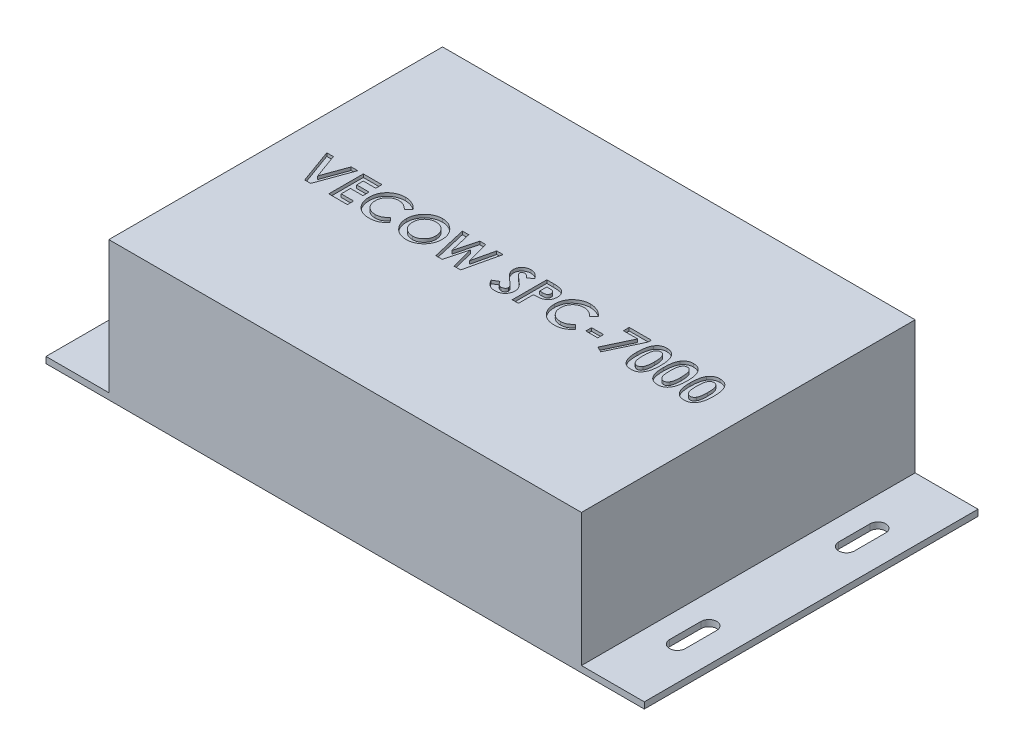
from build123d import *

# Parameters (mm, degrees)
SKETCH1_W           = 150.4
SKETCH1_H           = 106.2
BOSS_EXTRUDE1_DEPTH = 44.2
SKETCH2_W           = 106.2
SKETCH2_H           = 2
BOSS_EXTRUDE2_DEPTH = 20
CUT_EXTRUDE1_DEPTH  = 20
SKETCH4_W           = 3.807692308
SKETCH4_H           = 1.833333333
CUT_EXTRUDE2_DEPTH  = 1


with BuildPart() as part:
    # Sketch1 → Boss-Extrude1 (new body)
    with BuildSketch(Plane(origin=(0, 0, 0), x_dir=(1, 0, 0), z_dir=(0, 1, 0))):
        Rectangle(SKETCH1_W, SKETCH1_H)
    extrude(amount=BOSS_EXTRUDE1_DEPTH)

    # Sketch2 → Boss-Extrude2 (add)
    with BuildSketch(Plane(origin=(75.2, 0, 0), x_dir=(0, 0, -1), z_dir=(1, 0, 0))):
        with Locations((0, 1)):
            Rectangle(SKETCH2_W, SKETCH2_H)
    boss_extrude2 = extrude(amount=BOSS_EXTRUDE2_DEPTH)

    # Mirror1: Boss-Extrude2 across plane
    add(boss_extrude2.mirror(Plane(origin=(0, 0, 0), x_dir=(0, 0, 1), z_dir=(1, 0, 0))))

    # Sketch3 → Cut-Extrude1 (cut)
    with BuildSketch(Plane.XZ):
        with BuildLine():
            Line((-82.05, 31.9), (-82.05, 21.9))
            ThreePointArc((-82.05, 21.9), (-84.55, 19.4), (-87.05, 21.9))
            Line((-87.05, 21.9), (-87.05, 31.9))
            ThreePointArc((-87.05, 31.9), (-84.55, 34.4), (-82.05, 31.9))
        make_face()
        with BuildLine():
            Line((-82.05, -21.9), (-82.05, -31.9))
            ThreePointArc((-82.05, -31.9), (-84.55, -34.4), (-87.05, -31.9))
            Line((-87.05, -31.9), (-87.05, -21.9))
            ThreePointArc((-87.05, -21.9), (-84.55, -19.4), (-82.05, -21.9))
        make_face()
        with BuildLine():
            Line((87.05, 31.9), (87.05, 21.9))
            ThreePointArc((87.05, 21.9), (84.55, 19.4), (82.05, 21.9))
            Line((82.05, 21.9), (82.05, 31.9))
            ThreePointArc((82.05, 31.9), (84.55, 34.4), (87.05, 31.9))
        make_face()
        with BuildLine():
            Line((87.05, -21.9), (87.05, -31.9))
            ThreePointArc((87.05, -31.9), (84.55, -34.4), (82.05, -31.9))
            Line((82.05, -31.9), (82.05, -21.9))
            ThreePointArc((82.05, -21.9), (84.55, -19.4), (87.05, -21.9))
        make_face()
    extrude(amount=-CUT_EXTRUDE1_DEPTH, mode=Mode.SUBTRACT)

    # Sketch4 → Cut-Extrude2 (cut)
    # profile 1 of 13: a face of its own
    with BuildSketch(Plane(origin=(0, 44.2, 0), x_dir=(1, 0, 0), z_dir=(0, 1, 0))):
        Polygon((-64.448717949, 5.5), (-62.33994391, 5.5), (-59.512820513, -2.313701923), (-56.679086538, 5.5), (-54.576923077, 5.5), (-58.565304487, -5.5), (-60.466947115, -5.5), align=None)
    # profile 2 of 13: a face of its own
    with BuildSketch(Plane(origin=(0, 44.2, 0), x_dir=(1, 0, 0), z_dir=(0, 1, 0))):
        Polygon((-52.814102564, 5.5), (-46.891025641, 5.5), (-46.891025641, 3.525641026), (-50.83974359, 3.525641026), (-50.83974359, 1.41025641), (-46.891025641, 1.41025641), (-46.891025641, -0.564102564), (-50.83974359, -0.564102564), (-50.83974359, -3.525641026), (-46.891025641, -3.525641026), (-46.891025641, -5.5), (-52.814102564, -5.5), align=None)
    # profile 3 of 13: a face of its own
    with BuildSketch(Plane(origin=(0, 44.2, 0), x_dir=(1, 0, 0), z_dir=(0, 1, 0))):
        with BuildLine():
            Line((-35.044871795, 3.591746795), (-36.492588141, 2.207932692))
            add(Edge.make_bspline(
                [(-36.492588141, 2.207932692), (-36.615395236, 2.334915434), (-36.855275966, 2.582952511), (-37.241814096, 2.911331743), (-37.643799677, 3.184991401), (-38.053412882, 3.415465822), (-38.478021466, 3.589836148), (-38.912715796, 3.716902742), (-39.360271524, 3.794370441), (-39.663160026, 3.803234117), (-39.815504808, 3.807692308)],
                knots=[0, 0, 0, 0, 1.115251505, 2.178435587, 3.19620269, 4.182487026, 5.141301733, 6.088180966, 7.038406374, 8, 8, 8, 8], degree=3))
            add(Edge.make_bspline(
                [(-39.815504808, 3.807692308), (-39.942731214, 3.804170181), (-40.193798509, 3.797219652), (-40.56243109, 3.74626542), (-40.915047205, 3.659615531), (-41.252853916, 3.540195934), (-41.57485721, 3.385673312), (-41.881732208, 3.196167264), (-42.172722323, 2.973389298), (-42.443983744, 2.718492077), (-42.692124158, 2.439997709), (-42.911372014, 2.142844883), (-43.095027263, 1.827714358), (-43.245750138, 1.497797546), (-43.363157431, 1.151567429), (-43.44700099, 0.789257101), (-43.495493863, 0.41043508), (-43.50273175, 0.152914693), (-43.506410256, 0.022035256)],
                knots=[0, 0, 0, 0, 1.035432265, 2.043311493, 3.022114605, 3.98653278, 4.95457646, 5.923598177, 6.917315552, 7.932509744, 8.948865224, 9.949768934, 10.933144597, 11.912367597, 12.897413939, 13.903909035, 14.934704909, 16, 16, 16, 16], degree=3))
            add(Edge.make_bspline(
                [(-43.506410256, 0.022035256), (-43.505350153, -0.069825089), (-43.503260667, -0.250883719), (-43.480387545, -0.518719682), (-43.443556427, -0.778583886), (-43.390252673, -1.030082705), (-43.323595804, -1.273434091), (-43.24539212, -1.510737424), (-43.147286749, -1.738713706), (-43.038388306, -1.960010733), (-42.911740672, -2.168590139), (-42.77519116, -2.367487913), (-42.627125507, -2.555729078), (-42.466584685, -2.732544099), (-42.291309281, -2.895169753), (-42.105829515, -3.048496386), (-41.907016601, -3.188685713), (-41.699000387, -3.319255941), (-41.479983875, -3.432683409), (-41.255909491, -3.535426781), (-41.023379816, -3.618869676), (-40.785226039, -3.686132261), (-40.542299237, -3.743329044), (-40.29222336, -3.778546861), (-40.037166253, -3.805216901), (-39.86479046, -3.80686362), (-39.778044872, -3.807692308)],
                knots=[0, 0, 0, 0, 1.103660481, 2.175337485, 3.227646561, 4.255952547, 5.262355991, 6.258840057, 7.255597736, 8.242457506, 9.22035537, 10.185017736, 11.140346927, 12.096287581, 13.051739095, 14.01125915, 14.986044842, 15.97314143, 16.960198552, 17.947847494, 18.933482797, 19.925264591, 20.920966487, 21.929612487, 22.958107872, 24, 24, 24, 24], degree=3))
            add(Edge.make_bspline(
                [(-39.778044872, -3.807692308), (-39.630909447, -3.80343637), (-39.341826599, -3.79507456), (-38.917555952, -3.72968639), (-38.513268294, -3.622126549), (-38.190244389, -3.495104628), (-37.937163692, -3.369668831), (-37.744497099, -3.253646896), (-37.545264825, -3.123863624), (-37.342775949, -2.975420852), (-37.134752871, -2.810099954), (-36.924867679, -2.624280094), (-36.707747276, -2.424080053), (-36.565513851, -2.28119335), (-36.492588141, -2.207932692)],
                knots=[0, 0, 0, 0, 1.404581149, 2.759636711, 4.088442092, 5.392261763, 6.066678138, 6.783632037, 7.538459478, 8.336747902, 9.180226004, 10.074962426, 11.012997595, 12, 12, 12, 12], degree=3))
            Line((-36.492588141, -2.207932692), (-35.088942308, -3.682091346))
            add(Edge.make_bspline(
                [(-35.088942308, -3.682091346), (-35.187611055, -3.777352924), (-35.380191347, -3.96328315), (-35.670693373, -4.227286723), (-35.96082979, -4.46452328), (-36.243591508, -4.683603471), (-36.523610458, -4.878144956), (-36.800856944, -5.048342027), (-37.072192415, -5.198499214), (-37.34325124, -5.326084189), (-37.615720086, -5.434417085), (-37.896058509, -5.527684597), (-38.185123529, -5.606585556), (-38.484680625, -5.670248269), (-38.791935711, -5.72129717), (-39.109764285, -5.755754883), (-39.436151157, -5.778919656), (-39.657544429, -5.781001203), (-39.769230769, -5.782051282)],
                knots=[0, 0, 0, 0, 1.244526981, 2.429050516, 3.560637417, 4.644440555, 5.67424972, 6.652764056, 7.595344123, 8.486817594, 9.369275933, 10.254498637, 11.166417451, 12.086725134, 13.032340136, 13.991389299, 14.986715468, 16, 16, 16, 16], degree=3))
            add(Edge.make_bspline(
                [(-39.769230769, -5.782051282), (-39.974384742, -5.776821498), (-40.37581404, -5.766588265), (-40.964098209, -5.690766934), (-41.522952379, -5.563653809), (-42.053736136, -5.383880789), (-42.556280703, -5.154229181), (-43.030457516, -4.872687094), (-43.475502305, -4.54000254), (-43.887819985, -4.160074905), (-44.260780949, -3.740476727), (-44.590435251, -3.289943397), (-44.863125301, -2.806260707), (-45.089545726, -2.296574198), (-45.266603521, -1.75855797), (-45.391222192, -1.191630055), (-45.468073617, -0.596337857), (-45.476481272, -0.189739563), (-45.480769231, 0.017628205)],
                knots=[0, 0, 0, 0, 1.078019885, 2.10938526, 3.111377082, 4.085535484, 5.04941344, 6.010039228, 6.978205633, 7.964457913, 8.951525778, 9.924444315, 10.892603023, 11.863865945, 12.85144698, 13.863884204, 14.910567087, 16, 16, 16, 16], degree=3))
            add(Edge.make_bspline(
                [(-45.480769231, 0.017628205), (-45.478957347, 0.152871694), (-45.475366637, 0.420891234), (-45.43762794, 0.815705731), (-45.385018001, 1.200579245), (-45.301557117, 1.571515511), (-45.200953253, 1.933511728), (-45.075839131, 2.282633417), (-44.926414574, 2.61988399), (-44.757495889, 2.945828025), (-44.56639987, 3.258330239), (-44.352924639, 3.554705746), (-44.122565879, 3.83724251), (-43.869788447, 4.102192156), (-43.598265528, 4.351880994), (-43.306771228, 4.584955911), (-42.99705874, 4.804759466), (-42.668289787, 5.005623459), (-42.326851474, 5.187315616), (-41.977050236, 5.347575858), (-41.619745495, 5.481516516), (-41.256447967, 5.59261535), (-40.885622725, 5.675542775), (-40.509916625, 5.73831616), (-40.12613286, 5.773406884), (-39.868455309, 5.779151459), (-39.73838141, 5.782051282)],
                knots=[0, 0, 0, 0, 1.071919942, 2.124283339, 3.142214191, 4.149696895, 5.136002878, 6.119640489, 7.086990633, 8.058538607, 9.028339693, 9.988281803, 10.952401235, 11.916291999, 12.888973767, 13.874849856, 14.873389453, 15.898127285, 16.927174885, 17.938320013, 18.946391617, 19.950418109, 20.947802303, 21.956882652, 22.968648068, 24, 24, 24, 24], degree=3))
            add(Edge.make_bspline(
                [(-39.73838141, 5.782051282), (-39.627415038, 5.780389031), (-39.406636033, 5.777081812), (-39.077859048, 5.749512542), (-38.751711467, 5.706215282), (-38.429360999, 5.640888938), (-38.108501864, 5.563338311), (-37.79335051, 5.461796463), (-37.478935254, 5.348608938), (-37.170187233, 5.213316364), (-36.866675479, 5.065632298), (-36.575510235, 4.898079361), (-36.291802861, 4.720968575), (-36.021840143, 4.523817748), (-35.760565098, 4.313777905), (-35.509343957, 4.089869094), (-35.270381331, 3.848358097), (-35.120421655, 3.677716321), (-35.044871795, 3.591746795)],
                knots=[0, 0, 0, 0, 0.996412454, 1.982464992, 2.961075852, 3.949442424, 4.934965278, 5.923860011, 6.921385422, 7.934793307, 8.949617135, 9.951082467, 10.950285876, 11.951772932, 12.951063433, 13.960125323, 14.972308753, 16, 16, 16, 16], degree=3))
        make_face()
    # profile 4 of 13: a face of its own
    with BuildSketch(Plane(origin=(0, 44.2, 0), x_dir=(1, 0, 0), z_dir=(0, 1, 0))):
        with BuildLine():
            add(Edge.make_bspline(
                [(-27.901041667, 5.782051282), (-27.709793185, 5.777099516), (-27.332225367, 5.767323609), (-26.776959355, 5.685833795), (-26.241857885, 5.553057825), (-25.727162927, 5.368489624), (-25.234163219, 5.127130145), (-24.761119785, 4.83582209), (-24.309727044, 4.489067192), (-23.884610508, 4.094954672), (-23.491726158, 3.666374516), (-23.151291639, 3.204931782), (-22.86098157, 2.722582915), (-22.620371808, 2.218035447), (-22.437102689, 1.687795147), (-22.308495169, 1.134565539), (-22.225871208, 0.558504013), (-22.216368181, 0.166284631), (-22.211538462, -0.033052885)],
                knots=[0, 0, 0, 0, 1.014329547, 2.002516266, 2.970391464, 3.935626869, 4.897733899, 5.877609409, 6.878433252, 7.912639331, 8.949961323, 9.958554974, 10.949718813, 11.932905612, 12.9188844, 13.919928257, 14.942845884, 16, 16, 16, 16], degree=3))
            add(Edge.make_bspline(
                [(-22.211538462, -0.033052885), (-22.216681904, -0.230144327), (-22.226817223, -0.618519338), (-22.305122097, -1.18927223), (-22.435895385, -1.736575596), (-22.616056115, -2.261668269), (-22.852302125, -2.762006879), (-23.136950832, -3.24078602), (-23.477513572, -3.693562506), (-23.861568687, -4.12009336), (-24.284380038, -4.507261634), (-24.732204379, -4.848453007), (-25.202973934, -5.1375657), (-25.695999647, -5.374467287), (-26.212338788, -5.558317884), (-26.750715935, -5.688037839), (-27.311097775, -5.766871275), (-27.692184601, -5.776940391), (-27.885616987, -5.782051282)],
                knots=[0, 0, 0, 0, 1.051557043, 2.072126891, 3.067553643, 4.050577992, 5.02905126, 6.015227836, 7.017913613, 8.04756643, 9.074058332, 10.072836633, 11.047628519, 12.017157415, 12.98668631, 13.966869689, 14.968021931, 16, 16, 16, 16], degree=3))
            add(Edge.make_bspline(
                [(-27.885616987, -5.782051282), (-28.087924069, -5.777466561), (-28.485429833, -5.768458211), (-29.067181298, -5.682792916), (-29.624549469, -5.553751057), (-30.152852132, -5.361163004), (-30.657469599, -5.120411744), (-31.134694296, -4.823912134), (-31.584365846, -4.472154161), (-32.003904858, -4.074146479), (-32.384008219, -3.638638778), (-32.719523992, -3.178563512), (-33.00253899, -2.697435252), (-33.233063567, -2.19502882), (-33.414799883, -1.674466549), (-33.542994205, -1.132578064), (-33.61872165, -0.570663012), (-33.629270044, -0.188999076), (-33.634615385, 0.004407051)],
                knots=[0, 0, 0, 0, 1.067978421, 2.098431617, 3.099715153, 4.085208694, 5.062210972, 6.048429807, 7.046490867, 8.072918869, 9.098532598, 10.095778865, 11.076610158, 12.041847152, 13.011192615, 13.984257998, 14.978533688, 16, 16, 16, 16], degree=3))
            add(Edge.make_bspline(
                [(-33.634615385, 0.004407051), (-33.632937709, 0.134520569), (-33.6296036, 0.393100068), (-33.589440749, 0.776301686), (-33.53161779, 1.152023723), (-33.446100377, 1.51876817), (-33.342218579, 1.879122238), (-33.207625034, 2.229731663), (-33.054421156, 2.574341916), (-32.875416849, 2.90888272), (-32.676381368, 3.23027602), (-32.459215938, 3.537005747), (-32.223374498, 3.825363091), (-31.969616774, 4.097243016), (-31.69706828, 4.350858438), (-31.409314111, 4.589799634), (-31.100773511, 4.807719478), (-30.778199467, 5.009940006), (-30.443410576, 5.192804523), (-30.097769733, 5.348453331), (-29.748397822, 5.484378783), (-29.390627705, 5.59165716), (-29.028293527, 5.679034276), (-28.657524479, 5.736818263), (-28.28167025, 5.776980002), (-28.028218964, 5.780356844), (-27.901041667, 5.782051282)],
                knots=[0, 0, 0, 0, 1.034744296, 2.056386356, 3.06226378, 4.057406941, 5.050368692, 6.043467995, 7.042652155, 8.049140477, 9.059438543, 10.048523776, 11.036952808, 12.020949711, 13.004946614, 13.997082645, 14.994316842, 16.007702937, 17.024872941, 18.026463647, 19.021641123, 20.005082605, 20.995858141, 21.984425357, 22.988620895, 24, 24, 24, 24], degree=3))
        make_face()
        with BuildLine():
            add(Edge.make_bspline(
                [(-27.931891026, 3.807692308), (-28.060601228, 3.804238724), (-28.314623663, 3.797422732), (-28.687228313, 3.745494089), (-29.044941936, 3.662558145), (-29.385781583, 3.542426444), (-29.711224483, 3.389529277), (-30.021847546, 3.204400887), (-30.313349284, 2.980677691), (-30.589616592, 2.730370391), (-30.839178644, 2.451470535), (-31.05967459, 2.152581907), (-31.244194182, 1.834203647), (-31.398730496, 1.499293413), (-31.51506209, 1.144085228), (-31.597921597, 0.771361477), (-31.650285712, 0.380479937), (-31.656886274, 0.114016501), (-31.66025641, -0.022035256)],
                knots=[0, 0, 0, 0, 1.033739768, 2.040188636, 3.016340934, 3.979330865, 4.937572243, 5.900995986, 6.878200029, 7.884839167, 8.891893314, 9.879764717, 10.863503415, 11.843163062, 12.837761627, 13.859916423, 14.907309254, 16, 16, 16, 16], degree=3))
            add(Edge.make_bspline(
                [(-31.66025641, -0.022035256), (-31.655788124, -0.172811208), (-31.647031024, -0.46830709), (-31.585415004, -0.899368522), (-31.479996127, -1.306463262), (-31.327773318, -1.68760027), (-31.138977098, -2.047011787), (-30.904522158, -2.380292714), (-30.628205556, -2.689438582), (-30.415333485, -2.869930817), (-30.307291667, -2.961538462)],
                knots=[0, 0, 0, 0, 1.078454662, 2.113592447, 3.107694534, 4.079536787, 5.043276885, 6.005368276, 6.987637804, 8, 8, 8, 8], degree=3))
            add(Edge.make_bspline(
                [(-30.307291667, -2.961538462), (-30.218784791, -3.029214671), (-30.043765116, -3.163042334), (-29.764395608, -3.334569938), (-29.476700026, -3.481586206), (-29.178507345, -3.600373611), (-28.870447333, -3.693809787), (-28.552562235, -3.759241605), (-28.225302466, -3.800305729), (-28.003994073, -3.80521367), (-27.892227564, -3.807692308)],
                knots=[0, 0, 0, 0, 1.023928204, 2.024787132, 3.009472467, 3.9914905, 4.972207045, 5.96565515, 6.972602802, 8, 8, 8, 8], degree=3))
            add(Edge.make_bspline(
                [(-27.892227564, -3.807692308), (-27.765730537, -3.804209441), (-27.516843657, -3.797356792), (-27.151175243, -3.74606742), (-26.800853797, -3.659267284), (-26.463704493, -3.540189421), (-26.140699519, -3.385372498), (-25.833417487, -3.194502005), (-25.54131965, -2.969921588), (-25.265404304, -2.716327205), (-25.013204634, -2.436328676), (-24.793168818, -2.135845807), (-24.602782425, -1.821499135), (-24.451459696, -1.48883956), (-24.330532103, -1.141007231), (-24.248669853, -0.776461676), (-24.19586338, -0.396705688), (-24.189260958, -0.138268318), (-24.185897436, -0.006610577)],
                knots=[0, 0, 0, 0, 1.026359118, 2.019393844, 2.989460624, 3.950973911, 4.916101784, 5.890408035, 6.881132271, 7.902007068, 8.92769091, 9.933912415, 10.920395702, 11.90457117, 12.894218921, 13.903490204, 14.931958862, 16, 16, 16, 16], degree=3))
            add(Edge.make_bspline(
                [(-24.185897436, -0.006610577), (-24.189377337, 0.124290095), (-24.196226991, 0.381948105), (-24.247606635, 0.760727743), (-24.333856307, 1.123663937), (-24.453291749, 1.4713494), (-24.605804484, 1.804124994), (-24.794401953, 2.120820481), (-25.018422391, 2.421129696), (-25.272709981, 2.703006146), (-25.549486393, 2.962032547), (-25.846633528, 3.186820378), (-26.155836873, 3.382153855), (-26.484191063, 3.535170214), (-26.824978246, 3.657078022), (-27.180277923, 3.746852682), (-27.551435813, 3.79705793), (-27.8039422, 3.804115918), (-27.931891026, 3.807692308)],
                knots=[0, 0, 0, 0, 1.055025985, 2.07665775, 3.074803781, 4.057872707, 5.035505728, 6.020516407, 7.023567878, 8.050795229, 9.077271434, 10.074415901, 11.050397877, 12.019801805, 12.988065821, 13.964604439, 14.968634123, 16, 16, 16, 16], degree=3))
        make_face(mode=Mode.SUBTRACT)
    # profile 5 of 13: a face of its own
    with BuildSketch(Plane(origin=(0, 44.2, 0), x_dir=(1, 0, 0), z_dir=(0, 1, 0))):
        Polygon((-21.294871795, 5.5), (-19.256610577, 5.5), (-17.628205128, -1.522636218), (-15.76181891, 5.5), (-13.842548077, 5.5), (-11.987179487, -1.522636218), (-10.36318109, 5.5), (-8.320512821, 5.5), (-10.865584936, -5.5), (-12.928084936, -5.5), (-14.807692308, 1.610777244), (-16.698317308, -5.5), (-18.745392628, -5.5), align=None)
    # profile 6 of 13: a face of its own
    with BuildSketch(Plane(origin=(0, 44.2, 0), x_dir=(1, 0, 0), z_dir=(0, 1, 0))):
        with BuildLine():
            Line((3.314102564, 4.030248397), (1.837740385, 2.679487179))
            add(Edge.make_bspline(
                [(1.837740385, 2.679487179), (1.774499359, 2.76869522), (1.65308541, 2.939962218), (1.456286062, 3.169292765), (1.260375364, 3.364928788), (1.063538323, 3.52605301), (0.864030249, 3.651686482), (0.66219746, 3.740636368), (0.459184202, 3.797182654), (0.322790631, 3.804224028), (0.255608974, 3.807692308)],
                knots=[0, 0, 0, 0, 1.299362458, 2.494594718, 3.587462134, 4.587049575, 5.512617175, 6.380583204, 7.202344345, 8, 8, 8, 8], degree=3))
            add(Edge.make_bspline(
                [(0.255608974, 3.807692308), (0.192943852, 3.805494646), (0.071953965, 3.80125154), (-0.100526096, 3.759075374), (-0.25365635, 3.686285507), (-0.387287349, 3.591106632), (-0.493142816, 3.476438153), (-0.577660197, 3.356180403), (-0.625250585, 3.223443044), (-0.631514417, 3.132273671), (-0.634615385, 3.087139423)],
                knots=[0, 0, 0, 0, 1.185010067, 2.2879431, 3.333075148, 4.379039566, 5.372662701, 6.27520591, 7.14612461, 8, 8, 8, 8], degree=3))
            add(Edge.make_bspline(
                [(-0.634615385, 3.087139423), (-0.632672165, 3.041354319), (-0.628758791, 2.949149483), (-0.590960925, 2.814011813), (-0.533988747, 2.681966577), (-0.479549506, 2.601584359), (-0.451722756, 2.560496795)],
                knots=[0, 0, 0, 0, 0.967525499, 1.948461899, 2.951351359, 4, 4, 4, 4], degree=3))
            add(Edge.make_bspline(
                [(-0.451722756, 2.560496795), (-0.426425231, 2.528559861), (-0.368193669, 2.455045257), (-0.257158006, 2.338609584), (-0.117720532, 2.195965693), (0.055484599, 2.032018689), (0.255267167, 1.840872397), (0.490887351, 1.630040849), (0.755562975, 1.39299484), (0.943688277, 1.227924582), (1.042267628, 1.141426282)],
                knots=[0, 0, 0, 0, 0.473873513, 1.090794244, 1.870441696, 2.795289791, 3.865433203, 5.087734844, 6.473946851, 8, 8, 8, 8], degree=3))
            add(Edge.make_bspline(
                [(1.042267628, 1.141426282), (1.13479853, 1.061345454), (1.310402957, 0.90936868), (1.560253185, 0.693662051), (1.779829923, 0.499596056), (1.972331903, 0.330083211), (2.134840983, 0.183344938), (2.268040353, 0.05867983), (2.373556815, -0.041485113), (2.433536746, -0.1019848), (2.459134615, -0.127804487)],
                knots=[0, 0, 0, 0, 1.543621617, 2.929473131, 4.163658386, 5.240097082, 6.164993805, 6.925417477, 7.541396219, 8, 8, 8, 8], degree=3))
            add(Edge.make_bspline(
                [(2.459134615, -0.127804487), (2.556247595, -0.23290153), (2.742932847, -0.434934954), (2.985557863, -0.748023224), (3.1852461, -1.053661215), (3.339728706, -1.357600003), (3.456400184, -1.664224818), (3.538655121, -1.981055618), (3.587918151, -2.311403086), (3.593387497, -2.536824905), (3.596153846, -2.650841346)],
                knots=[0, 0, 0, 0, 1.206664779, 2.319633467, 3.337109185, 4.282041471, 5.190008762, 6.099243693, 7.03861361, 8, 8, 8, 8], degree=3))
            add(Edge.make_bspline(
                [(3.596153846, -2.650841346), (3.59418483, -2.761936385), (3.590321546, -2.979908986), (3.543003734, -3.298879419), (3.47553131, -3.604147967), (3.371207107, -3.892392876), (3.244057385, -4.1683456), (3.084656845, -4.427707671), (2.897462768, -4.67310394), (2.682909613, -4.900147649), (2.445588347, -5.106174078), (2.191038735, -5.289583671), (1.916771662, -5.441011652), (1.625130423, -5.565701793), (1.316271127, -5.661739808), (0.990561718, -5.732720851), (0.647504002, -5.775322554), (0.412916192, -5.779776056), (0.29306891, -5.782051282)],
                knots=[0, 0, 0, 0, 1.043214005, 2.046824704, 3.02475056, 3.976699089, 4.921714032, 5.875962561, 6.831408892, 7.817874052, 8.806269674, 9.781291748, 10.760897367, 11.74438705, 12.757449933, 13.795994037, 14.874007457, 16, 16, 16, 16], degree=3))
            add(Edge.make_bspline(
                [(0.29306891, -5.782051282), (0.198989814, -5.780382256), (0.01265925, -5.777076628), (-0.261963832, -5.750088924), (-0.527143461, -5.706533641), (-0.782580938, -5.64410591), (-1.029427053, -5.565001507), (-1.267691943, -5.46837851), (-1.495730787, -5.352739298), (-1.715269035, -5.220461872), (-1.92523946, -5.066870357), (-2.128297056, -4.895104881), (-2.322424861, -4.702523613), (-2.508555232, -4.489582001), (-2.685497255, -4.255677046), (-2.859042878, -4.004066307), (-3.021479211, -3.73008023), (-3.12182336, -3.537876781), (-3.173076923, -3.439703526)],
                knots=[0, 0, 0, 0, 1.016823716, 2.013894106, 2.979844003, 3.91962641, 4.853723003, 5.779685073, 6.695824784, 7.614987388, 8.547259901, 9.504950863, 10.487499108, 11.500346958, 12.559593716, 13.656357062, 14.802919212, 16, 16, 16, 16], degree=3))
            Line((-3.173076923, -3.439703526), (-1.436698718, -2.397435897))
            add(Edge.make_bspline(
                [(-1.436698718, -2.397435897), (-1.37258817, -2.508875369), (-1.249682771, -2.722514361), (-1.041408082, -3.009565424), (-0.828041296, -3.255377144), (-0.604649564, -3.455604782), (-0.373949245, -3.61292564), (-0.134826004, -3.72535804), (0.112888162, -3.794953568), (0.281619799, -3.803452789), (0.365785256, -3.807692308)],
                knots=[0, 0, 0, 0, 1.283663364, 2.460892379, 3.537111102, 4.529833553, 5.449777664, 6.316464042, 7.160231139, 8, 8, 8, 8], degree=3))
            add(Edge.make_bspline(
                [(0.365785256, -3.807692308), (0.451393577, -3.804230087), (0.617486186, -3.797512875), (0.854562131, -3.735468013), (1.071922335, -3.638053027), (1.259806889, -3.499055276), (1.418895684, -3.338630745), (1.536312346, -3.160151119), (1.610074285, -2.967040472), (1.617872711, -2.832893114), (1.621794872, -2.765424679)],
                knots=[0, 0, 0, 0, 1.13588714, 2.203786484, 3.234766741, 4.283437687, 5.291419208, 6.222934724, 7.106237994, 8, 8, 8, 8], degree=3))
            add(Edge.make_bspline(
                [(1.621794872, -2.765424679), (1.618172917, -2.702656281), (1.610815261, -2.575148287), (1.55662104, -2.385564404), (1.471898942, -2.196066741), (1.371666726, -2.04063563), (1.269667896, -1.910497374), (1.172134008, -1.797738463), (1.053363533, -1.673159606), (0.913657621, -1.536604093), (0.754862152, -1.386869792), (0.57684336, -1.223971364), (0.377562743, -1.04934375), (0.23671081, -0.930389145), (0.163060897, -0.868189103)],
                knots=[0, 0, 0, 0, 0.916159276, 1.861089862, 2.860218735, 3.940849679, 4.552606315, 5.27541173, 6.11797699, 7.06649574, 8.129236253, 9.306560635, 10.591630461, 12, 12, 12, 12], degree=3))
            add(Edge.make_bspline(
                [(0.163060897, -0.868189103), (0.023049483, -0.74972602), (-0.2456748, -0.522359508), (-0.625416304, -0.186546328), (-0.967597402, 0.127301859), (-1.269262648, 0.423064902), (-1.534255726, 0.695280745), (-1.760781987, 0.946160427), (-1.946352936, 1.177639143), (-2.141626346, 1.451810191), (-2.327175128, 1.785906452), (-2.48754193, 2.187862985), (-2.591581142, 2.589768516), (-2.603237289, 2.859585752), (-2.608974359, 2.992387821)],
                knots=[0, 0, 0, 0, 1.345494975, 2.582412109, 3.71882943, 4.751509156, 5.681369928, 6.505683931, 7.230279997, 7.856715994, 8.973648664, 10.023341002, 11.027102913, 12, 12, 12, 12], degree=3))
            add(Edge.make_bspline(
                [(-2.608974359, 2.992387821), (-2.606588319, 3.086563919), (-2.601887564, 3.272100951), (-2.559956107, 3.544906121), (-2.497287947, 3.808140189), (-2.406275786, 4.060842756), (-2.288152991, 4.302697302), (-2.144697445, 4.534887807), (-1.973681554, 4.755277242), (-1.780958191, 4.963719504), (-1.568626388, 5.154212011), (-1.341722872, 5.322340736), (-1.101531939, 5.464344701), (-0.849522953, 5.582147302), (-0.584134322, 5.67231771), (-0.30732115, 5.736234989), (-0.018686399, 5.774250948), (0.177636728, 5.779418777), (0.277644231, 5.782051282)],
                knots=[0, 0, 0, 0, 1.010766082, 1.991317756, 2.957454644, 3.913069143, 4.869106762, 5.843196583, 6.838735724, 7.860187025, 8.887984031, 9.89767229, 10.887916223, 11.879572884, 12.879850636, 13.892031539, 14.926195476, 16, 16, 16, 16], degree=3))
            add(Edge.make_bspline(
                [(0.277644231, 5.782051282), (0.407249005, 5.777310063), (0.665435498, 5.767865051), (1.047171675, 5.694008144), (1.420035612, 5.577860377), (1.72049636, 5.437740875), (1.959567369, 5.302007047), (2.142792965, 5.177040437), (2.329234872, 5.033884467), (2.520396627, 4.872088018), (2.712726149, 4.68860263), (2.911692287, 4.487796318), (3.114583883, 4.267933646), (3.246431251, 4.110864772), (3.314102564, 4.030248397)],
                knots=[0, 0, 0, 0, 1.282922637, 2.555718331, 3.837320111, 5.142675274, 5.830281639, 6.55870424, 7.337177975, 8.157850921, 9.037902056, 9.96903443, 10.957596896, 12, 12, 12, 12], degree=3))
        make_face()
    # profile 7 of 13: a face of its own
    with BuildSketch(Plane(origin=(0, 44.2, 0), x_dir=(1, 0, 0), z_dir=(0, 1, 0))):
        with BuildLine():
            Line((5.570512821, 5.5), (7.774038462, 5.5))
            add(Edge.make_bspline(
                [(7.774038462, 5.5), (7.918013968, 5.499355535), (8.1957729, 5.498112227), (8.596324132, 5.483035462), (8.965852255, 5.456016982), (9.304272372, 5.422626413), (9.611445331, 5.375814135), (9.887755807, 5.322147523), (10.133261139, 5.25676597), (10.350729766, 5.179158973), (10.545900834, 5.087663356), (10.730595613, 4.990213992), (10.90063998, 4.873911614), (11.064616588, 4.751290797), (11.213150613, 4.610637622), (11.355508495, 4.461312763), (11.485660989, 4.297394117), (11.604211175, 4.120865875), (11.711754461, 3.934989526), (11.80571147, 3.739432777), (11.881924134, 3.53388618), (11.945857082, 3.319679388), (11.99720865, 3.096821736), (12.031389887, 2.863942631), (12.054607504, 2.622668122), (12.056656138, 2.458456539), (12.057692308, 2.375400641)],
                knots=[0, 0, 0, 0, 1.698747864, 3.27724071, 4.728299578, 6.070144658, 7.288476769, 8.393259625, 9.389771311, 10.283485332, 11.113357557, 11.931608583, 12.74405601, 13.541433047, 14.344816069, 15.154114104, 15.974336324, 16.810834471, 17.661136416, 18.50621059, 19.367396281, 20.244825668, 21.142564693, 22.063065223, 23.020325768, 24, 24, 24, 24], degree=3))
            add(Edge.make_bspline(
                [(12.057692308, 2.375400641), (12.056193099, 2.283517879), (12.05324697, 2.102956961), (12.024365413, 1.838276807), (11.975026589, 1.585928243), (11.910543326, 1.343783171), (11.820626002, 1.115825411), (11.717899682, 0.896615824), (11.591513724, 0.692300371), (11.447097563, 0.500323314), (11.289378639, 0.319123788), (11.114612712, 0.153933587), (10.926130895, 0.003626614), (10.725024244, -0.133372358), (10.510537741, -0.256786973), (10.282826152, -0.367772877), (10.04033453, -0.462780397), (9.871470661, -0.512468561), (9.785857372, -0.537660256)],
                knots=[0, 0, 0, 0, 1.102006807, 2.165578795, 3.188629044, 4.184801286, 5.166646146, 6.124351954, 7.085497154, 8.042432466, 9.003981491, 9.963833307, 10.922997304, 11.89326795, 12.880200226, 13.889073926, 14.929769137, 16, 16, 16, 16], degree=3))
            add(Edge.make_bspline(
                [(9.785857372, -0.537660256), (9.729467535, -0.551690139), (9.607308989, -0.582083383), (9.405170148, -0.612940154), (9.172226358, -0.641311058), (8.907724358, -0.665692415), (8.611511657, -0.682266057), (8.283875067, -0.695209334), (7.924666107, -0.704620433), (7.674886401, -0.70495438), (7.544871795, -0.705128205)],
                knots=[0, 0, 0, 0, 0.618981996, 1.340914327, 2.176866532, 3.120127938, 4.170906482, 5.338178032, 6.614476169, 8, 8, 8, 8], degree=3))
            Line((7.544871795, -0.705128205), (7.544871795, -5.5))
            Line((7.544871795, -5.5), (5.570512821, -5.5))
            Line((5.570512821, -5.5), (5.570512821, 5.5))
        make_face()
        with BuildLine():
            Line((7.544871795, 1.269230769), (8.243389423, 1.269230769))
            add(Edge.make_bspline(
                [(8.243389423, 1.269230769), (8.370495734, 1.270036722), (8.604373233, 1.271519687), (8.923767308, 1.292964221), (9.18043853, 1.325714356), (9.383213562, 1.372685624), (9.543323655, 1.443970742), (9.681408587, 1.526434201), (9.799847559, 1.63070698), (9.902398275, 1.749856472), (9.984384483, 1.886765211), (10.041237648, 2.039203902), (10.078168345, 2.203969647), (10.081579238, 2.318635699), (10.083333333, 2.377604167)],
                knots=[0, 0, 0, 0, 1.8619151, 3.425951444, 4.686033666, 5.651700536, 6.461346321, 7.243864085, 7.999046032, 8.762387399, 9.539336099, 10.322741239, 11.137448474, 12, 12, 12, 12], degree=3))
            add(Edge.make_bspline(
                [(10.083333333, 2.377604167), (10.081597282, 2.429124149), (10.078228924, 2.529085301), (10.053484053, 2.673354038), (10.014047847, 2.807842263), (9.9569063, 2.931145423), (9.88303581, 3.043054007), (9.792972734, 3.14352393), (9.687872758, 3.234706841), (9.606729432, 3.282971348), (9.565504808, 3.307491987)],
                knots=[0, 0, 0, 0, 1.102301479, 2.1387299, 3.123554645, 4.094223062, 5.036071848, 5.982632524, 6.975082478, 8, 8, 8, 8], degree=3))
            add(Edge.make_bspline(
                [(9.565504808, 3.307491987), (9.530585171, 3.325151849), (9.456653144, 3.362541395), (9.330739735, 3.406009476), (9.185437584, 3.44267959), (9.019765737, 3.473115431), (8.834385107, 3.496736805), (8.629328769, 3.514801246), (8.404294963, 3.522065662), (8.247797416, 3.524416366), (8.166266026, 3.525641026)],
                knots=[0, 0, 0, 0, 0.656809284, 1.390599849, 2.23162475, 3.173112763, 4.218524733, 5.370385145, 6.63003504, 8, 8, 8, 8], degree=3))
            Line((8.166266026, 3.525641026), (7.544871795, 3.525641026))
            Line((7.544871795, 3.525641026), (7.544871795, 1.269230769))
        make_face(mode=Mode.SUBTRACT)
    # profile 8 of 13: a face of its own
    with BuildSketch(Plane(origin=(0, 44.2, 0), x_dir=(1, 0, 0), z_dir=(0, 1, 0))):
        with BuildLine():
            Line((23.903846154, 3.591746795), (22.456129808, 2.207932692))
            add(Edge.make_bspline(
                [(22.456129808, 2.207932692), (22.333322713, 2.334915434), (22.093441983, 2.582952511), (21.706903853, 2.911331743), (21.304918272, 3.184991401), (20.895305067, 3.415465822), (20.470696483, 3.589836148), (20.036002153, 3.716902742), (19.588446425, 3.794370441), (19.285557923, 3.803234117), (19.133213141, 3.807692308)],
                knots=[0, 0, 0, 0, 1.115251505, 2.178435587, 3.19620269, 4.182487026, 5.141301733, 6.088180966, 7.038406374, 8, 8, 8, 8], degree=3))
            add(Edge.make_bspline(
                [(19.133213141, 3.807692308), (19.005986735, 3.804170181), (18.75491944, 3.797219652), (18.386286859, 3.74626542), (18.033670743, 3.659615531), (17.695864033, 3.540195934), (17.373860739, 3.385673312), (17.06698574, 3.196167264), (16.775995626, 2.973389298), (16.504734205, 2.718492077), (16.256593791, 2.439997709), (16.037345935, 2.142844883), (15.853690686, 1.827714358), (15.702967811, 1.497797546), (15.585560517, 1.151567429), (15.501716959, 0.789257101), (15.453224085, 0.41043508), (15.445986199, 0.152914693), (15.442307692, 0.022035256)],
                knots=[0, 0, 0, 0, 1.035432265, 2.043311493, 3.022114605, 3.98653278, 4.95457646, 5.923598177, 6.917315552, 7.932509744, 8.948865224, 9.949768934, 10.933144597, 11.912367597, 12.897413939, 13.903909035, 14.934704909, 16, 16, 16, 16], degree=3))
            add(Edge.make_bspline(
                [(15.442307692, 0.022035256), (15.443367796, -0.069825089), (15.445457282, -0.250883719), (15.468330403, -0.518719682), (15.505161522, -0.778583886), (15.558465276, -1.030082705), (15.625122144, -1.273434091), (15.703325829, -1.510737424), (15.8014312, -1.738713706), (15.910329643, -1.960010733), (16.036977276, -2.168590139), (16.173526789, -2.367487913), (16.321592441, -2.555729078), (16.482133264, -2.732544099), (16.657408668, -2.895169753), (16.842888434, -3.048496386), (17.041701348, -3.188685713), (17.249717562, -3.319255941), (17.468734074, -3.432683409), (17.692808458, -3.535426781), (17.925338132, -3.618869676), (18.16349191, -3.686132261), (18.406418712, -3.743329044), (18.656494589, -3.778546861), (18.911551696, -3.805216901), (19.083927489, -3.80686362), (19.170673077, -3.807692308)],
                knots=[0, 0, 0, 0, 1.103660481, 2.175337485, 3.227646561, 4.255952547, 5.262355991, 6.258840057, 7.255597736, 8.242457506, 9.22035537, 10.185017736, 11.140346927, 12.096287581, 13.051739095, 14.01125915, 14.986044842, 15.97314143, 16.960198552, 17.947847494, 18.933482797, 19.925264591, 20.920966487, 21.929612487, 22.958107872, 24, 24, 24, 24], degree=3))
            add(Edge.make_bspline(
                [(19.170673077, -3.807692308), (19.317808502, -3.80343637), (19.60689135, -3.79507456), (20.031161997, -3.72968639), (20.435449655, -3.622126549), (20.758473559, -3.495104628), (21.011554256, -3.369668831), (21.20422085, -3.253646896), (21.403453123, -3.123863624), (21.605942, -2.975420852), (21.813965078, -2.810099954), (22.023850269, -2.624280094), (22.240970673, -2.424080053), (22.383204098, -2.28119335), (22.456129808, -2.207932692)],
                knots=[0, 0, 0, 0, 1.404581149, 2.759636711, 4.088442092, 5.392261763, 6.066678138, 6.783632037, 7.538459478, 8.336747902, 9.180226004, 10.074962426, 11.012997595, 12, 12, 12, 12], degree=3))
            Line((22.456129808, -2.207932692), (23.859775641, -3.682091346))
            add(Edge.make_bspline(
                [(23.859775641, -3.682091346), (23.761106894, -3.777352924), (23.568526601, -3.96328315), (23.278024576, -4.227286723), (22.987888158, -4.46452328), (22.705126441, -4.683603471), (22.425107491, -4.878144956), (22.147861005, -5.048342027), (21.876525533, -5.198499214), (21.605466709, -5.326084189), (21.332997863, -5.434417085), (21.05265944, -5.527684597), (20.763594419, -5.606585556), (20.464037323, -5.670248269), (20.156782238, -5.72129717), (19.838953664, -5.755754883), (19.512566792, -5.778919656), (19.29117352, -5.781001203), (19.179487179, -5.782051282)],
                knots=[0, 0, 0, 0, 1.244526981, 2.429050516, 3.560637417, 4.644440555, 5.67424972, 6.652764056, 7.595344123, 8.486817594, 9.369275933, 10.254498637, 11.166417451, 12.086725134, 13.032340136, 13.991389299, 14.986715468, 16, 16, 16, 16], degree=3))
            add(Edge.make_bspline(
                [(19.179487179, -5.782051282), (18.974333207, -5.776821498), (18.572903909, -5.766588265), (17.98461974, -5.690766934), (17.42576557, -5.563653809), (16.894981813, -5.383880789), (16.392437245, -5.154229181), (15.918260433, -4.872687094), (15.473215644, -4.54000254), (15.060897964, -4.160074905), (14.687937, -3.740476727), (14.358282698, -3.289943397), (14.085592647, -2.806260707), (13.859172222, -2.296574198), (13.682114428, -1.75855797), (13.557495757, -1.191630055), (13.480644332, -0.596337857), (13.472236677, -0.189739563), (13.467948718, 0.017628205)],
                knots=[0, 0, 0, 0, 1.078019885, 2.10938526, 3.111377082, 4.085535484, 5.04941344, 6.010039228, 6.978205633, 7.964457913, 8.951525778, 9.924444315, 10.892603023, 11.863865945, 12.85144698, 13.863884204, 14.910567087, 16, 16, 16, 16], degree=3))
            add(Edge.make_bspline(
                [(13.467948718, 0.017628205), (13.469760601, 0.152871694), (13.473351312, 0.420891234), (13.511090009, 0.815705731), (13.563699948, 1.200579245), (13.647160832, 1.571515511), (13.747764695, 1.933511728), (13.872878818, 2.282633417), (14.022303375, 2.61988399), (14.19122206, 2.945828025), (14.382318079, 3.258330239), (14.59579331, 3.554705746), (14.826152069, 3.83724251), (15.078929502, 4.102192156), (15.350452421, 4.351880994), (15.64194672, 4.584955911), (15.951659208, 4.804759466), (16.280428161, 5.005623459), (16.621866475, 5.187315616), (16.971667712, 5.347575858), (17.328972454, 5.481516516), (17.692269982, 5.59261535), (18.063095224, 5.675542775), (18.438801324, 5.73831616), (18.822585089, 5.773406884), (19.08026264, 5.779151459), (19.210336538, 5.782051282)],
                knots=[0, 0, 0, 0, 1.071919942, 2.124283339, 3.142214191, 4.149696895, 5.136002878, 6.119640489, 7.086990633, 8.058538607, 9.028339693, 9.988281803, 10.952401235, 11.916291999, 12.888973767, 13.874849856, 14.873389453, 15.898127285, 16.927174885, 17.938320013, 18.946391617, 19.950418109, 20.947802303, 21.956882652, 22.968648068, 24, 24, 24, 24], degree=3))
            add(Edge.make_bspline(
                [(19.210336538, 5.782051282), (19.321302911, 5.780389031), (19.542081915, 5.777081812), (19.870858901, 5.749512542), (20.197006482, 5.706215282), (20.51935695, 5.640888938), (20.840216085, 5.563338311), (21.155367439, 5.461796463), (21.469782695, 5.348608938), (21.778530716, 5.213316364), (22.082042469, 5.065632298), (22.373207714, 4.898079361), (22.656915088, 4.720968575), (22.926877806, 4.523817748), (23.18815285, 4.313777905), (23.439373992, 4.089869094), (23.678336618, 3.848358097), (23.828296294, 3.677716321), (23.903846154, 3.591746795)],
                knots=[0, 0, 0, 0, 0.996412454, 1.982464992, 2.961075852, 3.949442424, 4.934965278, 5.923860011, 6.921385422, 7.934793307, 8.949617135, 9.951082467, 10.950285876, 11.951772932, 12.951063433, 13.960125323, 14.972308753, 16, 16, 16, 16], degree=3))
        make_face()
    # profile 9 of 13: a face of its own
    with BuildSketch(Plane(origin=(0, 44.2, 0), x_dir=(1, 0, 0), z_dir=(0, 1, 0))):
        with Locations((27.782051282, -1.480769231)):
            Rectangle(SKETCH4_W, SKETCH4_H)
    # profile 10 of 13: a face of its own
    with BuildSketch(Plane(origin=(0, 44.2, 0), x_dir=(1, 0, 0), z_dir=(0, 1, 0))):
        Polygon((31.801282051, 5.5), (38.852564103, 5.5), (38.852564103, 4.475360577), (34.000400641, -5.782051282), (32.250801282, -4.900641026), (36.305288462, 3.666666667), (31.801282051, 3.666666667), align=None)
    # profile 11 of 13: a face of its own
    with BuildSketch(Plane(origin=(0, 44.2, 0), x_dir=(1, 0, 0), z_dir=(0, 1, 0))):
        with BuildLine():
            add(Edge.make_bspline(
                [(43.543870192, 5.782051282), (43.639437361, 5.78063256), (43.827347949, 5.777842975), (44.104104874, 5.74762949), (44.37069831, 5.701985341), (44.628171206, 5.63832767), (44.874670244, 5.554079009), (45.111989497, 5.453234806), (45.337304177, 5.330505575), (45.553487767, 5.191876605), (45.760456994, 5.034928959), (45.953237496, 4.856000539), (46.135349854, 4.659208495), (46.302852008, 4.441577684), (46.459453343, 4.20508769), (46.604639293, 3.949701013), (46.737298425, 3.674167706), (46.85891753, 3.377990547), (46.967669718, 3.056729968), (47.059271551, 2.706700972), (47.13783545, 2.327823624), (47.204148925, 1.919154839), (47.254271194, 1.4801514), (47.288054612, 1.011104959), (47.311238393, 0.512919767), (47.313130491, 0.17116882), (47.314102564, -0.004407051)],
                knots=[0, 0, 0, 0, 0.879237366, 1.728815576, 2.559023295, 3.367336655, 4.166867292, 4.954216142, 5.737608147, 6.525189134, 7.316157332, 8.124696809, 8.942788509, 9.781158001, 10.649253743, 11.551476218, 12.482711956, 13.461909668, 14.496590415, 15.601789533, 16.789733467, 18.056700938, 19.410929216, 20.8549011, 22.384193279, 24, 24, 24, 24], degree=3))
            add(Edge.make_bspline(
                [(47.314102564, -0.004407051), (47.313052016, -0.182179574), (47.31101082, -0.527588396), (47.289018368, -1.030330242), (47.251146328, -1.502782242), (47.20233411, -1.944895518), (47.135474723, -2.356436597), (47.057173087, -2.738471092), (46.964125347, -3.090860528), (46.851790897, -3.412810894), (46.730907955, -3.709508205), (46.597885943, -3.984504287), (46.455043418, -4.238543984), (46.305656754, -4.475459828), (46.141536027, -4.688267661), (45.970669455, -4.884204063), (45.785617201, -5.055805564), (45.594170681, -5.211915735), (45.389316435, -5.346826252), (45.173167071, -5.464816765), (44.941869021, -5.560521085), (44.699638455, -5.643759591), (44.442346504, -5.703515857), (44.174081501, -5.75093049), (43.89181479, -5.777134725), (43.699636243, -5.780385533), (43.601161859, -5.782051282)],
                knots=[0, 0, 0, 0, 1.643780988, 3.193836972, 4.651895693, 6.025988579, 7.305620092, 8.505800249, 9.631074763, 10.672816429, 11.65661981, 12.592235626, 13.49536222, 14.350718032, 15.179365177, 15.97804903, 16.751647189, 17.51006938, 18.259804725, 19.016521909, 19.783502495, 20.571750527, 21.382245291, 22.22305063, 23.089471752, 24, 24, 24, 24], degree=3))
            add(Edge.make_bspline(
                [(43.601161859, -5.782051282), (43.502690133, -5.780353402), (43.309785469, -5.777027278), (43.02675548, -5.75112533), (42.757068808, -5.70332378), (42.497741264, -5.643300827), (42.250577727, -5.560705259), (42.014393055, -5.462137534), (41.791003305, -5.344883223), (41.579789944, -5.209658377), (41.381474117, -5.054592701), (41.192973995, -4.881344795), (41.014706552, -4.690353798), (40.849383678, -4.479480452), (40.694297863, -4.251539478), (40.551066406, -4.0039279), (40.419775386, -3.737006235), (40.296317996, -3.450402422), (40.189049151, -3.137946208), (40.093584859, -2.7968474), (40.015383022, -2.424262657), (39.952487873, -2.020311677), (39.902272421, -1.585850248), (39.864917897, -1.120668666), (39.842803288, -0.624550263), (39.840783498, -0.283543371), (39.83974359, -0.107972756)],
                knots=[0, 0, 0, 0, 0.917216111, 1.796812873, 2.643793957, 3.46689424, 4.273913431, 5.068098542, 5.848489301, 6.620921603, 7.401012384, 8.190319798, 9.003608147, 9.831726257, 10.68377682, 11.569763213, 12.493818149, 13.453288342, 14.474581811, 15.568529029, 16.750744269, 18.018426408, 19.375425659, 20.823733699, 22.36466933, 24, 24, 24, 24], degree=3))
            add(Edge.make_bspline(
                [(39.83974359, -0.107972756), (39.841627286, 0.135968792), (39.845261902, 0.606657151), (39.891322423, 1.286664978), (39.958927585, 1.915214419), (40.058223555, 2.491254067), (40.181001648, 3.016917404), (40.33822539, 3.488741635), (40.517213182, 3.913255506), (40.669733776, 4.164740079), (40.743189103, 4.285857372)],
                knots=[0, 0, 0, 0, 1.288568992, 2.486310467, 3.599230591, 4.627010532, 5.572937695, 6.447898582, 7.252493626, 8, 8, 8, 8], degree=3))
            add(Edge.make_bspline(
                [(40.743189103, 4.285857372), (40.828599457, 4.404842962), (40.995593531, 4.637483237), (41.287587336, 4.942896432), (41.601296662, 5.204100752), (41.943164921, 5.415184909), (42.307785323, 5.581645892), (42.698288319, 5.69921541), (43.113231849, 5.76771689), (43.398180492, 5.777201799), (43.543870192, 5.782051282)],
                knots=[0, 0, 0, 0, 1.058512271, 2.069600068, 3.047294572, 4.004278952, 4.967380941, 5.939006123, 6.946246673, 8, 8, 8, 8], degree=3))
        make_face()
        with BuildLine():
            add(Edge.make_bspline(
                [(43.592347756, 3.807692308), (43.505954243, 3.803597427), (43.336577097, 3.795569287), (43.090802787, 3.727421705), (42.859052959, 3.62216409), (42.682767054, 3.495503008), (42.550818808, 3.374083171), (42.458625622, 3.264202168), (42.369719825, 3.141582887), (42.291193747, 3.000692152), (42.217044632, 2.846592332), (42.144578597, 2.678583907), (42.085175476, 2.492540227), (42.026813485, 2.291629639), (41.975682935, 2.070297499), (41.932846743, 1.826734662), (41.894576371, 1.559357215), (41.86788233, 1.267990027), (41.842995474, 0.952937938), (41.825155396, 0.613499136), (41.817696907, 0.249765194), (41.815326081, -0.000732974), (41.814102564, -0.130008013)],
                knots=[0, 0, 0, 0, 1.076674018, 2.110852608, 3.161083442, 4.239746716, 4.804137807, 5.395870207, 6.026861976, 6.692161227, 7.405688833, 8.16177676, 8.973626916, 9.841385931, 10.773283133, 11.807421078, 12.927755683, 14.143907515, 15.458935494, 16.872852025, 18.386167141, 20, 20, 20, 20], degree=3))
            add(Edge.make_bspline(
                [(41.814102564, -0.130008013), (41.816116324, -0.297490075), (41.819977858, -0.618649346), (41.84020277, -1.080487561), (41.880741927, -1.500797525), (41.931164453, -1.882427834), (42.001984949, -2.222903513), (42.083468515, -2.525445779), (42.184093474, -2.786197952), (42.300385002, -3.008931094), (42.42918311, -3.198409716), (42.568999121, -3.359467398), (42.715072803, -3.498935751), (42.871963589, -3.612224176), (43.039297184, -3.699043203), (43.215676662, -3.761491057), (43.401214109, -3.799717989), (43.52826824, -3.805018836), (43.592347756, -3.807692308)],
                knots=[0, 0, 0, 0, 1.771748488, 3.397459088, 4.888034009, 6.237357457, 7.467047327, 8.564189669, 9.548206622, 10.417051504, 11.216568818, 11.965764335, 12.669334354, 13.348544111, 14.005342236, 14.656555988, 15.322436492, 16, 16, 16, 16], degree=3))
            add(Edge.make_bspline(
                [(43.592347756, -3.807692308), (43.654228267, -3.805862919), (43.775382612, -3.802281205), (43.952052781, -3.765515384), (44.119124646, -3.705742144), (44.276093766, -3.621188701), (44.423521597, -3.51366606), (44.560687602, -3.382701723), (44.686557303, -3.226990279), (44.759889562, -3.111429359), (44.797676282, -3.051883013)],
                knots=[0, 0, 0, 0, 0.992283464, 1.942767638, 2.88273346, 3.832339453, 4.79467288, 5.803907806, 6.868395428, 8, 8, 8, 8], degree=3))
            add(Edge.make_bspline(
                [(44.797676282, -3.051883013), (44.84216378, -2.970514834), (44.935450457, -2.799892362), (45.04340196, -2.511973302), (45.134269518, -2.187248189), (45.212477897, -1.824706448), (45.265967657, -1.422918168), (45.312032973, -0.984431125), (45.33425142, -0.507037275), (45.337865371, -0.176297093), (45.33974359, -0.004407051)],
                knots=[0, 0, 0, 0, 0.710965849, 1.490837728, 2.352621235, 3.297892224, 4.334225155, 5.461620853, 6.680770821, 8, 8, 8, 8], degree=3))
            add(Edge.make_bspline(
                [(45.33974359, -0.004407051), (45.339018075, 0.168975079), (45.337621582, 0.502706083), (45.311999983, 0.981816197), (45.276319949, 1.419403772), (45.224130359, 1.81449185), (45.156978965, 2.168039535), (45.07421462, 2.480023713), (44.976641613, 2.751059245), (44.860931655, 2.980875873), (44.732775687, 3.17618848), (44.596734215, 3.343751548), (44.452232, 3.486812667), (44.299510697, 3.605910203), (44.135035517, 3.696909652), (43.961948152, 3.761162792), (43.779893759, 3.800033786), (43.655706889, 3.80510501), (43.592347756, 3.807692308)],
                knots=[0, 0, 0, 0, 1.793836731, 3.452829483, 4.963243077, 6.335886805, 7.574563692, 8.684454726, 9.672768357, 10.54971625, 11.340229787, 12.085688095, 12.778991901, 13.440269426, 14.083255152, 14.715733572, 15.344777694, 16, 16, 16, 16], degree=3))
        make_face(mode=Mode.SUBTRACT)
    # profile 12 of 13: a face of its own
    with BuildSketch(Plane(origin=(0, 44.2, 0), x_dir=(1, 0, 0), z_dir=(0, 1, 0))):
        with BuildLine():
            add(Edge.make_bspline(
                [(52.005408654, 5.782051282), (52.100975823, 5.78063256), (52.288886411, 5.777842975), (52.565643335, 5.74762949), (52.832236772, 5.701985341), (53.089709667, 5.63832767), (53.336208706, 5.554079009), (53.573527958, 5.453234806), (53.798842639, 5.330505575), (54.015026229, 5.191876605), (54.221995455, 5.034928959), (54.414775957, 4.856000539), (54.596888316, 4.659208495), (54.764390469, 4.441577684), (54.920991804, 4.20508769), (55.066177755, 3.949701013), (55.198836886, 3.674167706), (55.320455991, 3.377990547), (55.429208179, 3.056729968), (55.520810012, 2.706700972), (55.599373912, 2.327823624), (55.665687386, 1.919154839), (55.715809655, 1.4801514), (55.749593073, 1.011104959), (55.772776854, 0.512919767), (55.774668953, 0.17116882), (55.775641026, -0.004407051)],
                knots=[0, 0, 0, 0, 0.879237366, 1.728815576, 2.559023295, 3.367336655, 4.166867292, 4.954216142, 5.737608147, 6.525189134, 7.316157332, 8.124696809, 8.942788509, 9.781158001, 10.649253743, 11.551476218, 12.482711956, 13.461909668, 14.496590415, 15.601789533, 16.789733467, 18.056700938, 19.410929216, 20.8549011, 22.384193279, 24, 24, 24, 24], degree=3))
            add(Edge.make_bspline(
                [(55.775641026, -0.004407051), (55.774590477, -0.182179574), (55.772549281, -0.527588396), (55.75055683, -1.030330242), (55.71268479, -1.502782242), (55.663872572, -1.944895518), (55.597013185, -2.356436597), (55.518711548, -2.738471092), (55.425663808, -3.090860528), (55.313329358, -3.412810894), (55.192446416, -3.709508205), (55.059424405, -3.984504287), (54.916581879, -4.238543984), (54.767195216, -4.475459828), (54.603074489, -4.688267661), (54.432207916, -4.884204063), (54.247155662, -5.055805564), (54.055709143, -5.211915735), (53.850854897, -5.346826252), (53.634705533, -5.464816765), (53.403407483, -5.560521085), (53.161176917, -5.643759591), (52.903884966, -5.703515857), (52.635619963, -5.75093049), (52.353353251, -5.777134725), (52.161174705, -5.780385533), (52.062700321, -5.782051282)],
                knots=[0, 0, 0, 0, 1.643780988, 3.193836972, 4.651895693, 6.025988579, 7.305620092, 8.505800249, 9.631074763, 10.672816429, 11.65661981, 12.592235626, 13.49536222, 14.350718032, 15.179365177, 15.97804903, 16.751647189, 17.51006938, 18.259804725, 19.016521909, 19.783502495, 20.571750527, 21.382245291, 22.22305063, 23.089471752, 24, 24, 24, 24], degree=3))
            add(Edge.make_bspline(
                [(52.062700321, -5.782051282), (51.964228594, -5.780353402), (51.77132393, -5.777027278), (51.488293941, -5.75112533), (51.218607269, -5.70332378), (50.959279725, -5.643300827), (50.712116188, -5.560705259), (50.475931517, -5.462137534), (50.252541766, -5.344883223), (50.041328406, -5.209658377), (49.843012578, -5.054592701), (49.654512457, -4.881344795), (49.476245014, -4.690353798), (49.31092214, -4.479480452), (49.155836325, -4.251539478), (49.012604868, -4.0039279), (48.881313848, -3.737006235), (48.757856457, -3.450402422), (48.650587612, -3.137946208), (48.55512332, -2.7968474), (48.476921484, -2.424262657), (48.414026334, -2.020311677), (48.363810883, -1.585850248), (48.326456358, -1.120668666), (48.304341749, -0.624550263), (48.302321959, -0.283543371), (48.301282051, -0.107972756)],
                knots=[0, 0, 0, 0, 0.917216111, 1.796812873, 2.643793957, 3.46689424, 4.273913431, 5.068098542, 5.848489301, 6.620921603, 7.401012384, 8.190319798, 9.003608147, 9.831726257, 10.68377682, 11.569763213, 12.493818149, 13.453288342, 14.474581811, 15.568529029, 16.750744269, 18.018426408, 19.375425659, 20.823733699, 22.36466933, 24, 24, 24, 24], degree=3))
            add(Edge.make_bspline(
                [(48.301282051, -0.107972756), (48.303165747, 0.135968792), (48.306800363, 0.606657151), (48.352860884, 1.286664978), (48.420466047, 1.915214419), (48.519762017, 2.491254067), (48.64254011, 3.016917404), (48.799763851, 3.488741635), (48.978751644, 3.913255506), (49.131272238, 4.164740079), (49.204727564, 4.285857372)],
                knots=[0, 0, 0, 0, 1.288568992, 2.486310467, 3.599230591, 4.627010532, 5.572937695, 6.447898582, 7.252493626, 8, 8, 8, 8], degree=3))
            add(Edge.make_bspline(
                [(49.204727564, 4.285857372), (49.290137919, 4.404842962), (49.457131992, 4.637483237), (49.749125797, 4.942896432), (50.062835124, 5.204100752), (50.404703382, 5.415184909), (50.769323784, 5.581645892), (51.159826781, 5.69921541), (51.57477031, 5.76771689), (51.859718953, 5.777201799), (52.005408654, 5.782051282)],
                knots=[0, 0, 0, 0, 1.058512271, 2.069600068, 3.047294572, 4.004278952, 4.967380941, 5.939006123, 6.946246673, 8, 8, 8, 8], degree=3))
        make_face()
        with BuildLine():
            add(Edge.make_bspline(
                [(52.053886218, 3.807692308), (51.967492705, 3.803597427), (51.798115558, 3.795569287), (51.552341249, 3.727421705), (51.320591421, 3.62216409), (51.144305516, 3.495503008), (51.012357269, 3.374083171), (50.920164083, 3.264202168), (50.831258286, 3.141582887), (50.752732209, 3.000692152), (50.678583094, 2.846592332), (50.606117058, 2.678583907), (50.546713938, 2.492540227), (50.488351946, 2.291629639), (50.437221396, 2.070297499), (50.394385205, 1.826734662), (50.356114833, 1.559357215), (50.329420792, 1.267990027), (50.304533935, 0.952937938), (50.286693858, 0.613499136), (50.279235369, 0.249765194), (50.276864542, -0.000732974), (50.275641026, -0.130008013)],
                knots=[0, 0, 0, 0, 1.076674018, 2.110852608, 3.161083442, 4.239746716, 4.804137807, 5.395870207, 6.026861976, 6.692161227, 7.405688833, 8.16177676, 8.973626916, 9.841385931, 10.773283133, 11.807421078, 12.927755683, 14.143907515, 15.458935494, 16.872852025, 18.386167141, 20, 20, 20, 20], degree=3))
            add(Edge.make_bspline(
                [(50.275641026, -0.130008013), (50.277654786, -0.297490075), (50.28151632, -0.618649346), (50.301741232, -1.080487561), (50.342280388, -1.500797525), (50.392702914, -1.882427834), (50.463523411, -2.222903513), (50.545006977, -2.525445779), (50.645631935, -2.786197952), (50.761923464, -3.008931094), (50.890721571, -3.198409716), (51.030537583, -3.359467398), (51.176611264, -3.498935751), (51.33350205, -3.612224176), (51.500835646, -3.699043203), (51.677215124, -3.761491057), (51.862752571, -3.799717989), (51.989806701, -3.805018836), (52.053886218, -3.807692308)],
                knots=[0, 0, 0, 0, 1.771748488, 3.397459088, 4.888034009, 6.237357457, 7.467047327, 8.564189669, 9.548206622, 10.417051504, 11.216568818, 11.965764335, 12.669334354, 13.348544111, 14.005342236, 14.656555988, 15.322436492, 16, 16, 16, 16], degree=3))
            add(Edge.make_bspline(
                [(52.053886218, -3.807692308), (52.115766729, -3.805862919), (52.236921074, -3.802281205), (52.413591243, -3.765515384), (52.580663108, -3.705742144), (52.737632227, -3.621188701), (52.885060058, -3.51366606), (53.022226063, -3.382701723), (53.148095765, -3.226990279), (53.221428024, -3.111429359), (53.259214744, -3.051883013)],
                knots=[0, 0, 0, 0, 0.992283464, 1.942767638, 2.88273346, 3.832339453, 4.79467288, 5.803907806, 6.868395428, 8, 8, 8, 8], degree=3))
            add(Edge.make_bspline(
                [(53.259214744, -3.051883013), (53.303702242, -2.970514834), (53.396988918, -2.799892362), (53.504940421, -2.511973302), (53.59580798, -2.187248189), (53.674016358, -1.824706448), (53.727506119, -1.422918168), (53.773571435, -0.984431125), (53.795789882, -0.507037275), (53.799403833, -0.176297093), (53.801282051, -0.004407051)],
                knots=[0, 0, 0, 0, 0.710965849, 1.490837728, 2.352621235, 3.297892224, 4.334225155, 5.461620853, 6.680770821, 8, 8, 8, 8], degree=3))
            add(Edge.make_bspline(
                [(53.801282051, -0.004407051), (53.800556536, 0.168975079), (53.799160043, 0.502706083), (53.773538444, 0.981816197), (53.73785841, 1.419403772), (53.68566882, 1.81449185), (53.618517427, 2.168039535), (53.535753081, 2.480023713), (53.438180074, 2.751059245), (53.322470116, 2.980875873), (53.194314148, 3.17618848), (53.058272677, 3.343751548), (52.913770462, 3.486812667), (52.761049158, 3.605910203), (52.596573979, 3.696909652), (52.423486614, 3.761162792), (52.24143222, 3.800033786), (52.117245351, 3.80510501), (52.053886218, 3.807692308)],
                knots=[0, 0, 0, 0, 1.793836731, 3.452829483, 4.963243077, 6.335886805, 7.574563692, 8.684454726, 9.672768357, 10.54971625, 11.340229787, 12.085688095, 12.778991901, 13.440269426, 14.083255152, 14.715733572, 15.344777694, 16, 16, 16, 16], degree=3))
        make_face(mode=Mode.SUBTRACT)
    # profile 13 of 13: a face of its own
    with BuildSketch(Plane(origin=(0, 44.2, 0), x_dir=(1, 0, 0), z_dir=(0, 1, 0))):
        with BuildLine():
            add(Edge.make_bspline(
                [(60.466947115, 5.782051282), (60.562514284, 5.78063256), (60.750424872, 5.777842975), (61.027181797, 5.74762949), (61.293775233, 5.701985341), (61.551248129, 5.63832767), (61.797747167, 5.554079009), (62.03506642, 5.453234806), (62.2603811, 5.330505575), (62.476564691, 5.191876605), (62.683533917, 5.034928959), (62.876314419, 4.856000539), (63.058426777, 4.659208495), (63.225928931, 4.441577684), (63.382530266, 4.20508769), (63.527716216, 3.949701013), (63.660375348, 3.674167706), (63.781994453, 3.377990547), (63.890746641, 3.056729968), (63.982348474, 2.706700972), (64.060912373, 2.327823624), (64.127225848, 1.919154839), (64.177348117, 1.4801514), (64.211131535, 1.011104959), (64.234315316, 0.512919767), (64.236207414, 0.17116882), (64.237179487, -0.004407051)],
                knots=[0, 0, 0, 0, 0.879237366, 1.728815576, 2.559023295, 3.367336655, 4.166867292, 4.954216142, 5.737608147, 6.525189134, 7.316157332, 8.124696809, 8.942788509, 9.781158001, 10.649253743, 11.551476218, 12.482711956, 13.461909668, 14.496590415, 15.601789533, 16.789733467, 18.056700938, 19.410929216, 20.8549011, 22.384193279, 24, 24, 24, 24], degree=3))
            add(Edge.make_bspline(
                [(64.237179487, -0.004407051), (64.236128939, -0.182179574), (64.234087743, -0.527588396), (64.212095292, -1.030330242), (64.174223252, -1.502782242), (64.125411033, -1.944895518), (64.058551646, -2.356436597), (63.98025001, -2.738471092), (63.88720227, -3.090860528), (63.77486782, -3.412810894), (63.653984878, -3.709508205), (63.520962866, -3.984504287), (63.378120341, -4.238543984), (63.228733677, -4.475459828), (63.06461295, -4.688267661), (62.893746378, -4.884204063), (62.708694124, -5.055805564), (62.517247604, -5.211915735), (62.312393358, -5.346826252), (62.096243994, -5.464816765), (61.864945944, -5.560521085), (61.622715378, -5.643759591), (61.365423427, -5.703515857), (61.097158424, -5.75093049), (60.814891713, -5.777134725), (60.622713166, -5.780385533), (60.524238782, -5.782051282)],
                knots=[0, 0, 0, 0, 1.643780988, 3.193836972, 4.651895693, 6.025988579, 7.305620092, 8.505800249, 9.631074763, 10.672816429, 11.65661981, 12.592235626, 13.49536222, 14.350718032, 15.179365177, 15.97804903, 16.751647189, 17.51006938, 18.259804725, 19.016521909, 19.783502495, 20.571750527, 21.382245291, 22.22305063, 23.089471752, 24, 24, 24, 24], degree=3))
            add(Edge.make_bspline(
                [(60.524238782, -5.782051282), (60.425767056, -5.780353402), (60.232862392, -5.777027278), (59.949832403, -5.75112533), (59.680145731, -5.70332378), (59.420818187, -5.643300827), (59.17365465, -5.560705259), (58.937469978, -5.462137534), (58.714080228, -5.344883223), (58.502866868, -5.209658377), (58.30455104, -5.054592701), (58.116050918, -4.881344795), (57.937783475, -4.690353798), (57.772460602, -4.479480452), (57.617374786, -4.251539478), (57.474143329, -4.0039279), (57.342852309, -3.737006235), (57.219394919, -3.450402422), (57.112126074, -3.137946208), (57.016661782, -2.7968474), (56.938459945, -2.424262657), (56.875564796, -2.020311677), (56.825349344, -1.585850248), (56.78799482, -1.120668666), (56.765880211, -0.624550263), (56.763860421, -0.283543371), (56.762820513, -0.107972756)],
                knots=[0, 0, 0, 0, 0.917216111, 1.796812873, 2.643793957, 3.46689424, 4.273913431, 5.068098542, 5.848489301, 6.620921603, 7.401012384, 8.190319798, 9.003608147, 9.831726257, 10.68377682, 11.569763213, 12.493818149, 13.453288342, 14.474581811, 15.568529029, 16.750744269, 18.018426408, 19.375425659, 20.823733699, 22.36466933, 24, 24, 24, 24], degree=3))
            add(Edge.make_bspline(
                [(56.762820513, -0.107972756), (56.764704209, 0.135968792), (56.768338825, 0.606657151), (56.814399346, 1.286664978), (56.882004508, 1.915214419), (56.981300478, 2.491254067), (57.104078571, 3.016917404), (57.261302313, 3.488741635), (57.440290105, 3.913255506), (57.592810699, 4.164740079), (57.666266026, 4.285857372)],
                knots=[0, 0, 0, 0, 1.288568992, 2.486310467, 3.599230591, 4.627010532, 5.572937695, 6.447898582, 7.252493626, 8, 8, 8, 8], degree=3))
            add(Edge.make_bspline(
                [(57.666266026, 4.285857372), (57.75167638, 4.404842962), (57.918670454, 4.637483237), (58.210664259, 4.942896432), (58.524373585, 5.204100752), (58.866241844, 5.415184909), (59.230862246, 5.581645892), (59.621365242, 5.69921541), (60.036308772, 5.76771689), (60.321257415, 5.777201799), (60.466947115, 5.782051282)],
                knots=[0, 0, 0, 0, 1.058512271, 2.069600068, 3.047294572, 4.004278952, 4.967380941, 5.939006123, 6.946246673, 8, 8, 8, 8], degree=3))
        make_face()
        with BuildLine():
            add(Edge.make_bspline(
                [(60.515424679, 3.807692308), (60.429031166, 3.803597427), (60.25965402, 3.795569287), (60.013879711, 3.727421705), (59.782129882, 3.62216409), (59.605843977, 3.495503008), (59.473895731, 3.374083171), (59.381702545, 3.264202168), (59.292796748, 3.141582887), (59.214270671, 3.000692152), (59.140121556, 2.846592332), (59.06765552, 2.678583907), (59.008252399, 2.492540227), (58.949890408, 2.291629639), (58.898759858, 2.070297499), (58.855923666, 1.826734662), (58.817653294, 1.559357215), (58.790959253, 1.267990027), (58.766072397, 0.952937938), (58.748232319, 0.613499136), (58.74077383, 0.249765194), (58.738403004, -0.000732974), (58.737179487, -0.130008013)],
                knots=[0, 0, 0, 0, 1.076674018, 2.110852608, 3.161083442, 4.239746716, 4.804137807, 5.395870207, 6.026861976, 6.692161227, 7.405688833, 8.16177676, 8.973626916, 9.841385931, 10.773283133, 11.807421078, 12.927755683, 14.143907515, 15.458935494, 16.872852025, 18.386167141, 20, 20, 20, 20], degree=3))
            add(Edge.make_bspline(
                [(58.737179487, -0.130008013), (58.739193247, -0.297490075), (58.743054781, -0.618649346), (58.763279693, -1.080487561), (58.80381885, -1.500797525), (58.854241376, -1.882427834), (58.925061873, -2.222903513), (59.006545438, -2.525445779), (59.107170397, -2.786197952), (59.223461925, -3.008931094), (59.352260033, -3.198409716), (59.492076045, -3.359467398), (59.638149726, -3.498935751), (59.795040512, -3.612224176), (59.962374107, -3.699043203), (60.138753585, -3.761491057), (60.324291032, -3.799717989), (60.451345163, -3.805018836), (60.515424679, -3.807692308)],
                knots=[0, 0, 0, 0, 1.771748488, 3.397459088, 4.888034009, 6.237357457, 7.467047327, 8.564189669, 9.548206622, 10.417051504, 11.216568818, 11.965764335, 12.669334354, 13.348544111, 14.005342236, 14.656555988, 15.322436492, 16, 16, 16, 16], degree=3))
            add(Edge.make_bspline(
                [(60.515424679, -3.807692308), (60.57730519, -3.805862919), (60.698459535, -3.802281205), (60.875129704, -3.765515384), (61.042201569, -3.705742144), (61.199170689, -3.621188701), (61.34659852, -3.51366606), (61.483764525, -3.382701723), (61.609634226, -3.226990279), (61.682966486, -3.111429359), (61.720753205, -3.051883013)],
                knots=[0, 0, 0, 0, 0.992283464, 1.942767638, 2.88273346, 3.832339453, 4.79467288, 5.803907806, 6.868395428, 8, 8, 8, 8], degree=3))
            add(Edge.make_bspline(
                [(61.720753205, -3.051883013), (61.765240704, -2.970514834), (61.85852738, -2.799892362), (61.966478883, -2.511973302), (62.057346441, -2.187248189), (62.13555482, -1.824706448), (62.18904458, -1.422918168), (62.235109896, -0.984431125), (62.257328343, -0.507037275), (62.260942295, -0.176297093), (62.262820513, -0.004407051)],
                knots=[0, 0, 0, 0, 0.710965849, 1.490837728, 2.352621235, 3.297892224, 4.334225155, 5.461620853, 6.680770821, 8, 8, 8, 8], degree=3))
            add(Edge.make_bspline(
                [(62.262820513, -0.004407051), (62.262094998, 0.168975079), (62.260698505, 0.502706083), (62.235076906, 0.981816197), (62.199396872, 1.419403772), (62.147207282, 1.81449185), (62.080055889, 2.168039535), (61.997291543, 2.480023713), (61.899718536, 2.751059245), (61.784008578, 2.980875873), (61.65585261, 3.17618848), (61.519811138, 3.343751548), (61.375308923, 3.486812667), (61.22258762, 3.605910203), (61.058112441, 3.696909652), (60.885025075, 3.761162792), (60.702970682, 3.800033786), (60.578783812, 3.80510501), (60.515424679, 3.807692308)],
                knots=[0, 0, 0, 0, 1.793836731, 3.452829483, 4.963243077, 6.335886805, 7.574563692, 8.684454726, 9.672768357, 10.54971625, 11.340229787, 12.085688095, 12.778991901, 13.440269426, 14.083255152, 14.715733572, 15.344777694, 16, 16, 16, 16], degree=3))
        make_face(mode=Mode.SUBTRACT)
    extrude(amount=-CUT_EXTRUDE2_DEPTH, mode=Mode.SUBTRACT)


solid = part.part
